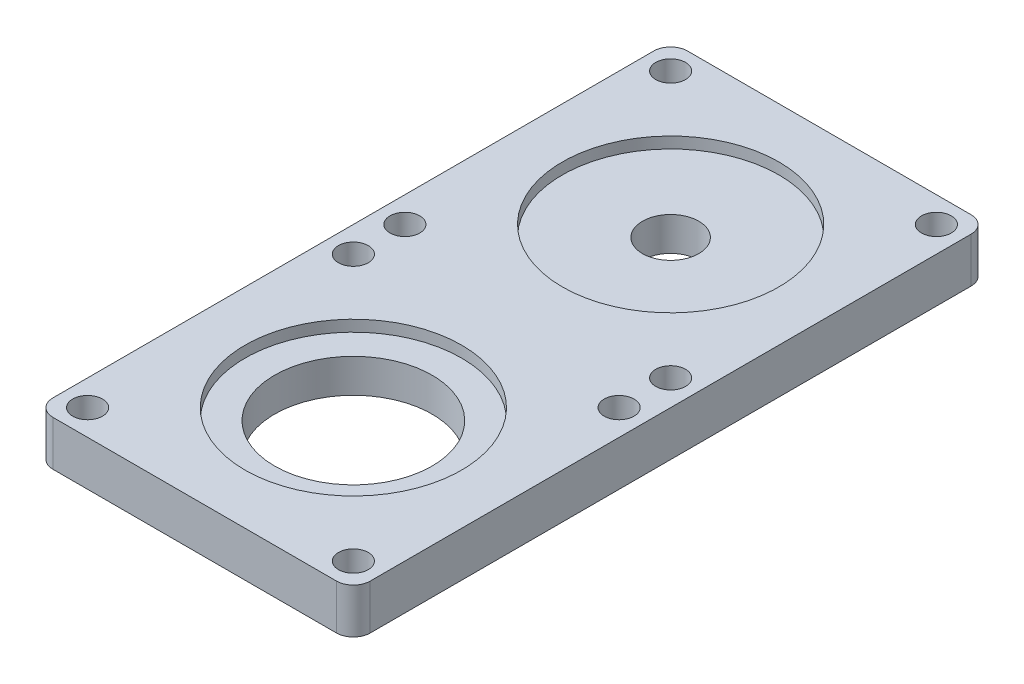
from build123d import *

# Parameters (mm, degrees)
SKETCH1_W           = 56.4
SKETCH1_H           = 112.8
BOSS_EXTRUDE1_DEPTH = 8
SKETCH2_R           = 19.25
CUT_EXTRUDE1_DEPTH  = 2
SKETCH3_R           = 5
CUT_EXTRUDE2_DEPTH  = 127.256881001
SKETCH4_R           = 2.65
CUT_EXTRUDE3_DEPTH  = 127.367717396
SKETCH5_R           = 14
CUT_EXTRUDE4_DEPTH  = 127.367717396
FILLET2_R           = 3


with BuildPart() as part:
    # Sketch1 → Boss-Extrude1 (new body)
    with BuildSketch(Plane(origin=(0, 0, 0), x_dir=(1, 0, 0), z_dir=(0, 1, 0))):
        with Locations((28.2, -56.4)):
            Rectangle(SKETCH1_W, SKETCH1_H)
    extrude(amount=BOSS_EXTRUDE1_DEPTH)

    # Sketch2 → Cut-Extrude1 (cut)
    with BuildSketch(Plane(origin=(0, 8, 0), x_dir=(1, 0, 0), z_dir=(0, 1, 0))):
        with Locations((28.2, -28.2)):
            Circle(SKETCH2_R)
    cut_extrude1 = extrude(amount=-CUT_EXTRUDE1_DEPTH, mode=Mode.SUBTRACT)

    # Sketch3 → Cut-Extrude2 (cut, through all)
    with BuildSketch(Plane(origin=(0, 6, 0), x_dir=(1, 0, 0), z_dir=(0, 1, 0))):
        with Locations((28.2, -28.2)):
            Circle(SKETCH3_R)
    extrude(amount=-CUT_EXTRUDE2_DEPTH, mode=Mode.SUBTRACT)

    # Sketch4 → Cut-Extrude3 (cut, through all)
    with BuildSketch(Plane(origin=(0, 8, 0), x_dir=(1, 0, 0), z_dir=(0, 1, 0))):
        with Locations((4.58, -4.58)):
            Circle(SKETCH4_R)
        with Locations((51.82, -4.58)):
            Circle(SKETCH4_R)
        with Locations((51.82, -51.82)):
            Circle(SKETCH4_R)
        with Locations((4.58, -51.82)):
            Circle(SKETCH4_R)
    cut_extrude3 = extrude(amount=-CUT_EXTRUDE3_DEPTH, mode=Mode.SUBTRACT)

    # Sketch5 → Cut-Extrude4 (cut, through all)
    with BuildSketch(Plane(origin=(0, 8, 0), x_dir=(1, 0, 0), z_dir=(0, 1, 0))):
        with Locations((28.2, -84.6)):
            Circle(SKETCH5_R)
    extrude(amount=-CUT_EXTRUDE4_DEPTH, mode=Mode.SUBTRACT)

    # Mirror1: Cut-Extrude3 across plane
    add(cut_extrude3.mirror(Plane.XY.offset(56.4)), mode=Mode.SUBTRACT)

    # Mirror2: Cut-Extrude1 across plane
    add(cut_extrude1.mirror(Plane.XY.offset(56.4)), mode=Mode.SUBTRACT)

    # Fillet2
    fillet2_edges = [part.edges().sort_by_distance(p)[0] for p in [
        (0, 4, 0),
        (56.4, 4, 0),
        (56.4, 4, 112.8),
        (0, 4, 112.8),
    ]]
    fillet(fillet2_edges, radius=FILLET2_R)


solid = part.part
